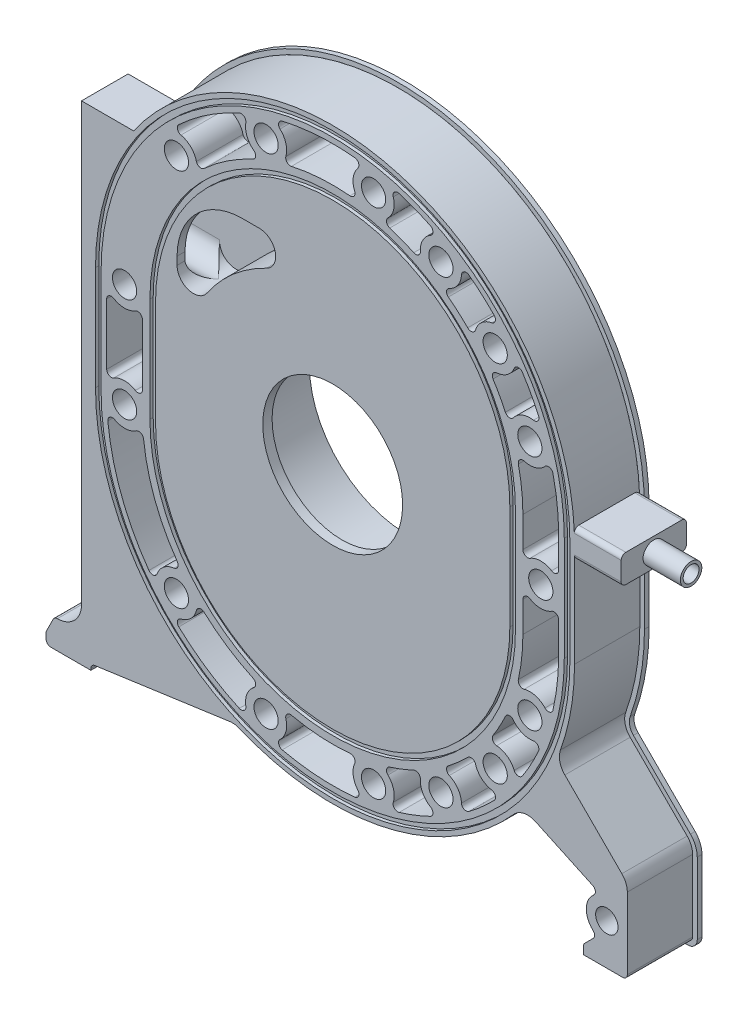
from build123d import *
from build123d.topology import SkipClean

# Parameters (mm, degrees)
BOSS_EXTRUDE1_START             = -25
BOSS_EXTRUDE1_OUTLINE_R         = 6.5
BOSS_EXTRUDE1_OUTLINE_R_2       = 6
BOSS_EXTRUDE1_DEPTH             = 50
SKETCH3_R                       = 37.5
CUT_EXTRUDE1_DEPTH              = 231.616869775
CUT_EXTRUDE2_DEPTH              = 60
CUT_EXTRUDE3_REACH              = 232.617
CUT_EXTRUDE4_REACH              = 285.707
CUT_EXTRUDE5_DEPTH              = 1.75
BOSS_EXTRUDE2_START             = -10
SKETCH1_5_R                     = 6.5
SKETCH1_5_R_2                   = 6
BOSS_EXTRUDE2_DEPTH             = 10
SKETCH9_R                       = 52.5
CUT_EXTRUDE6_DEPTH              = 30
EXTRUDE_THIN1_START             = 2.5
SKETCH11_R                      = 9
SKETCH11_R_2                    = 6.5
EXTRUDE_THIN1_DEPTH             = 2.5
SKETCH12_R                      = 67.5
SKETCH12_R_2                    = 3.125
SKETCH12_R_3                    = 52.5
BOSS_EXTRUDE4_DEPTH             = 5
BOSS_EXTRUDE8_DEPTH             = 25
BOSS_EXTRUDE8_DIRECTION_2_REACH = 331.971
CUT_EXTRUDE7_DEPTH              = 352.851730179
CUT_EXTRUDE7_DEPTH_BACK         = 45
SKETCH14_R                      = 4.25
EXTRUDE_THIN3_OUTLINE_R         = 5.75
EXTRUDE_THIN3_OUTLINE_R_2       = 4.25
EXTRUDE_THIN3_DEPTH             = 20


# Read off the part's stored shape, not the designer's step: Boss-Extrude1, Extrude-Thin3
with BuildPart() as part:
    # Boss-Extrude1 outline → Boss-Extrude1 (new body)
    with BuildSketch(Plane.XY.offset(BOSS_EXTRUDE1_START)):
        with BuildLine():
            Line((129.69, -27.875), (129.69, 27.875))
            ThreePointArc((129.69, 27.875), (38.606968436, 151.685331105), (-106.70444966, 101.588340195))
            Line((-106.70444966, 101.588340195), (-134.69, 101.588340195))
            Line((-134.69, 101.588340195), (-134.69, -132.375))
            ThreePointArc((-134.69, -132.375), (-138.484242845, -141.553999684), (-147.652159261, -145.374944926))
            ThreePointArc((-147.652159261, -145.374944926), (-148.962303708, -145.750222458), (-149.880950173, -146.756900346))
            Line((-149.880950173, -146.756900346), (-153.426067978, -153.847135955))
            ThreePointArc((-153.426067978, -153.847135955), (-153.623122474, -154.390787642), (-153.69, -154.965169944))
            Line((-153.69, -154.965169944), (-153.69, -157.875))
            ThreePointArc((-153.69, -157.875), (-152.957766953, -159.642766953), (-151.19, -160.375))
            Line((-151.19, -160.375), (-129.69, -160.375))
            Line((-129.69, -160.375), (-129.69, -159.548216845))
            ThreePointArc((-129.69, -159.548216845), (-129.076773951, -157.908069272), (-127.537932752, -157.072546673))
            Line((-127.537932752, -157.072546673), (-55.158579324, -146.900291927))
            ThreePointArc((-55.158579324, -146.900291927), (-52.4929471, -146.884445723), (-49.917836337, -147.573394791))
            ThreePointArc((-49.917836337, -147.573394791), (28.987217754, -154.284008013), (97.084575956, -113.863843529))
            ThreePointArc((97.084575956, -113.863843529), (102.536758276, -110.703163877), (108.796653859, -111.431102888))
            Line((108.796653859, -111.431102888), (139.437181695, -125.719015668))
            ThreePointArc((139.437181695, -125.719015668), (140.860155542, -127.665437295), (139.976814552, -129.908898999))
            ThreePointArc((139.976814552, -129.908898999), (136.002465891, -138.142097602), (139.624687231, -146.536174031))
            ThreePointArc((139.624687231, -146.536174031), (140.447681655, -148.3278198), (139.716246737, -150.158753263))
            Line((139.716246737, -150.158753263), (135.232233047, -154.642766953))
            ThreePointArc((135.232233047, -154.642766953), (134.690301169, -155.453825325), (134.5, -156.410533906))
            Line((134.5, -156.410533906), (134.5, -160.375))
            Line((134.5, -160.375), (155.5, -160.375))
            ThreePointArc((155.5, -160.375), (157.267766953, -159.642766953), (158, -157.875))
            Line((158, -157.875), (158, -119.517135624))
            ThreePointArc((158, -119.517135624), (157.238795325, -115.6903013), (155.071067812, -112.446067812))
            Line((155.071067812, -112.446067812), (124.500071536, -81.875071536))
            ThreePointArc((124.500071536, -81.875071536), (121.81521137, -76.99987924), (122.152344922, -71.444493114))
            ThreePointArc((122.152344922, -71.444493114), (127.791693222, -49.983352349), (129.69, -27.875))
        make_face()
        with Locations((-83.790831702, -101.588340195)):
            Circle(BOSS_EXTRUDE1_OUTLINE_R, mode=Mode.SUBTRACT)
        with Locations((-35.708318761, -133.608041058)):
            Circle(BOSS_EXTRUDE1_OUTLINE_R, mode=Mode.SUBTRACT)
        with BuildLine():
            ThreePointArc((11.802296503, -132.930451523), (11.019268702, -138.900082628), (13.484906294, -144.392828692))
            ThreePointArc((13.484906294, -144.392828692), (13.884371714, -146.944502352), (11.813453088, -148.487845195))
            ThreePointArc((11.813453088, -148.487845195), (-7.738201491, -148.817698571), (-27.088392238, -145.998812612))
            ThreePointArc((-27.088392238, -145.998812612), (-28.945736068, -144.204130193), (-28.224334891, -141.724172244))
            ThreePointArc((-28.224334891, -141.724172244), (-25.078790134, -136.590442972), (-25.094645122, -130.569697447))
            ThreePointArc((-25.094645122, -130.569697447), (-24.511119871, -128.167653252), (-22.148335068, -127.441315859))
            ThreePointArc((-22.148335068, -127.441315859), (-6.512885156, -129.666857862), (9.278701432, -129.452092397))
            ThreePointArc((9.278701432, -129.452092397), (11.529653187, -130.473627628), (11.802296503, -132.930451523))
        make_face(mode=Mode.SUBTRACT)
        with BuildLine():
            ThreePointArc((-42.306637167, -124.756838077), (-45.969574687, -129.535176364), (-46.580642928, -135.524852788))
            ThreePointArc((-46.580642928, -135.524852788), (-47.510532556, -137.934399709), (-50.075672117, -138.235514506))
            ThreePointArc((-50.075672117, -138.235514506), (-67.172828356, -128.74534862), (-82.521142132, -116.629026395))
            ThreePointArc((-82.521142132, -116.629026395), (-83.232307863, -114.146113914), (-81.367577143, -112.359107918))
            ThreePointArc((-81.367577143, -112.359107918), (-76.076590838, -109.48594033), (-73.079948898, -104.263894262))
            ThreePointArc((-73.079948898, -104.263894262), (-71.373579109, -102.475425594), (-68.96417875, -103.027791361))
            ThreePointArc((-68.96417875, -103.027791361), (-56.536252928, -112.772892229), (-42.752955044, -120.482693174))
            ThreePointArc((-42.752955044, -120.482693174), (-41.314341257, -122.492844513), (-42.306637167, -124.756838077))
        make_face(mode=Mode.SUBTRACT)
        with BuildLine():
            ThreePointArc((-85.079541574, -90.623814356), (-90.640907662, -92.93050794), (-94.164946494, -97.812185764))
            ThreePointArc((-94.164946494, -97.812185764), (-96.175027996, -99.433969795), (-98.547061418, -98.412173079))
            ThreePointArc((-98.547061418, -98.412173079), (-113.38922347, -70.652331624), (-120.581280229, -40.006403811))
            ThreePointArc((-120.581280229, -40.006403811), (-119.475235387, -37.672463817), (-116.894827512, -37.562435244))
            ThreePointArc((-116.894827512, -37.562435244), (-111.024514584, -38.899990546), (-105.325360652, -36.958529108))
            ThreePointArc((-105.325360652, -36.958529108), (-102.862886251, -36.74280276), (-101.418720173, -38.748968848))
            ThreePointArc((-101.418720173, -38.748968848), (-95.434448337, -63.878695236), (-83.328991742, -86.699137353))
            ThreePointArc((-83.328991742, -86.699137353), (-83.088191325, -89.159286371), (-85.079541574, -90.623814356))
        make_face(mode=Mode.SUBTRACT)
        with Locations((-111.6, -27.875)):
            Circle(BOSS_EXTRUDE1_OUTLINE_R, mode=Mode.SUBTRACT)
        with Locations((21.942209355, -137.296658956)):
            Circle(BOSS_EXTRUDE1_OUTLINE_R, mode=Mode.SUBTRACT)
        with BuildLine():
            ThreePointArc((47.021611519, -122.558209428), (48.327540158, -128.435639007), (52.523111405, -132.753834228))
            ThreePointArc((52.523111405, -132.753834228), (53.771209903, -135.014997917), (52.353037294, -137.173561684))
            ThreePointArc((52.353037294, -137.173561684), (44.099400772, -140.756614763), (35.60267048, -143.717418633))
            ThreePointArc((35.60267048, -143.717418633), (33.09682233, -143.091849982), (32.481595101, -140.583442809))
            ThreePointArc((32.481595101, -140.583442809), (32.638852133, -134.564730464), (29.614748548, -129.358539384))
            ThreePointArc((29.614748548, -129.358539384), (28.919074143, -126.986545465), (30.602137109, -125.176126429))
            ThreePointArc((30.602137109, -125.176126429), (37.116419496, -122.88221764), (43.460538967, -120.152741372))
            ThreePointArc((43.460538967, -120.152741372), (45.925127347, -120.342799649), (47.021611519, -122.558209428))
        make_face(mode=Mode.SUBTRACT)
        with Locations((58.043343694, -123.193047886)):
            Circle(BOSS_EXTRUDE1_OUTLINE_R, mode=Mode.SUBTRACT)
        with BuildLine():
            ThreePointArc((76.569426221, -100.765774901), (79.806797034, -105.842098205), (85.226254123, -108.46490451))
            ThreePointArc((85.226254123, -108.46490451), (87.1724466, -110.162828515), (86.578072553, -112.676258558))
            ThreePointArc((86.578072553, -112.676258558), (80.047667547, -118.866137043), (73.076007354, -124.554435503))
            ThreePointArc((73.076007354, -124.554435503), (70.50732326, -124.823643801), (69.071272992, -122.676932196))
            ThreePointArc((69.071272992, -122.676932196), (67.160525406, -116.967407546), (62.538175363, -113.109492547))
            ThreePointArc((62.538175363, -113.109492547), (61.073185557, -111.118482025), (62.035547628, -108.84160318))
            ThreePointArc((62.035547628, -108.84160318), (67.372407705, -104.458018222), (72.400394092, -99.723332864))
            ThreePointArc((72.400394092, -99.723332864), (74.781353365, -99.058990353), (76.569426221, -100.765774901))
        make_face(mode=Mode.SUBTRACT)
        with Locations((147, -138.375)):
            Circle(BOSS_EXTRUDE1_OUTLINE_R_2, mode=Mode.SUBTRACT)
        with Locations((87.143594155, -97.592673497)):
            Circle(BOSS_EXTRUDE1_OUTLINE_R, mode=Mode.SUBTRACT)
        with BuildLine():
            ThreePointArc((96.881838077, -70.181637167), (101.660176364, -73.844574687), (107.649852788, -74.455642928))
            ThreePointArc((107.649852788, -74.455642928), (110.059399709, -75.385532556), (110.360514506, -77.950672117))
            ThreePointArc((110.360514506, -77.950672117), (106.341004237, -86.000785309), (101.735299255, -93.730485615))
            ThreePointArc((101.735299255, -93.730485615), (99.413600426, -94.862000368), (97.329935976, -93.335909432))
            ThreePointArc((97.329935976, -93.335909432), (93.58164813, -88.624225414), (87.918575263, -86.579907982))
            ThreePointArc((87.918575263, -86.579907982), (85.860969449, -85.21002611), (85.986555557, -82.741312647))
            ThreePointArc((85.986555557, -82.741312647), (89.502289234, -76.796776562), (92.607693174, -70.627955044))
            ThreePointArc((92.607693174, -70.627955044), (94.617844513, -69.189341257), (96.881838077, -70.181637167))
        make_face(mode=Mode.SUBTRACT)
        with Locations((105.733041058, -63.583318761)):
            Circle(BOSS_EXTRUDE1_OUTLINE_R, mode=Mode.SUBTRACT)
        with BuildLine():
            ThreePointArc((105.810930576, -9.40044016), (111.595213419, -11.039998962), (117.380915805, -9.405456526))
            ThreePointArc((117.380915805, -9.405456526), (119.910100306, -9.353262352), (121.19, -11.53531534))
            Line((121.19, -11.53531534), (121.19, -27.875))
            ThreePointArc((121.19, -27.875), (120.421013429, -41.505686879), (118.123812612, -54.963392238))
            ThreePointArc((118.123812612, -54.963392238), (116.329130193, -56.820736068), (113.849172244, -56.099334891))
            ThreePointArc((113.849172244, -56.099334891), (108.715442972, -52.953790134), (102.694697447, -52.969645122))
            ThreePointArc((102.694697447, -52.969645122), (100.292653252, -52.386119871), (99.566315859, -50.023335068))
            ThreePointArc((99.566315859, -50.023335068), (101.38975347, -39.015820939), (102, -27.875))
            Line((102, -27.875), (102, -11.529163023))
            ThreePointArc((102, -11.529163023), (103.280845875, -9.346581244), (105.810930576, -9.40044016))
        make_face(mode=Mode.SUBTRACT)
        with BuildLine():
            ThreePointArc((-117.380915805, 18.469543474), (-111.595213419, 16.835001038), (-105.810930576, 18.47455984))
            ThreePointArc((-105.810930576, 18.47455984), (-103.280845875, 18.528418756), (-102, 16.345836977))
            Line((-102, 16.345836977), (-102, -16.345836977))
            ThreePointArc((-102, -16.345836977), (-103.280845875, -18.528418756), (-105.810930576, -18.47455984))
            ThreePointArc((-105.810930576, -18.47455984), (-111.595213419, -16.835001038), (-117.380915805, -18.469543474))
            ThreePointArc((-117.380915805, -18.469543474), (-119.910100306, -18.521737648), (-121.19, -16.33968466))
            Line((-121.19, -16.33968466), (-121.19, 16.33968466))
            ThreePointArc((-121.19, 16.33968466), (-119.910100306, 18.521737648), (-117.380915805, 18.469543474))
        make_face(mode=Mode.SUBTRACT)
        with Locations((-111.6, 27.875)):
            Circle(BOSS_EXTRUDE1_OUTLINE_R, mode=Mode.SUBTRACT)
        with Locations((-83.790831702, 101.588340195)):
            Circle(BOSS_EXTRUDE1_OUTLINE_R, mode=Mode.SUBTRACT)
        with BuildLine():
            ThreePointArc((-46.580642928, 135.524852788), (-45.969574687, 129.535176364), (-42.306637167, 124.756838077))
            ThreePointArc((-42.306637167, 124.756838077), (-41.314341257, 122.492844513), (-42.752955044, 120.482693174))
            ThreePointArc((-42.752955044, 120.482693174), (-56.536252928, 112.772892229), (-68.96417875, 103.027791361))
            ThreePointArc((-68.96417875, 103.027791361), (-71.373579109, 102.475425594), (-73.079948898, 104.263894262))
            ThreePointArc((-73.079948898, 104.263894262), (-76.076590838, 109.48594033), (-81.367577143, 112.359107918))
            ThreePointArc((-81.367577143, 112.359107918), (-83.232307863, 114.146113914), (-82.521142132, 116.629026395))
            ThreePointArc((-82.521142132, 116.629026395), (-67.172828356, 128.74534862), (-50.075672117, 138.235514506))
            ThreePointArc((-50.075672117, 138.235514506), (-47.510532556, 137.934399709), (-46.580642928, 135.524852788))
        make_face(mode=Mode.SUBTRACT)
        with Locations((-35.708318761, 133.608041058)):
            Circle(BOSS_EXTRUDE1_OUTLINE_R, mode=Mode.SUBTRACT)
        with BuildLine():
            ThreePointArc((13.484906294, 144.392828692), (11.019268702, 138.900082628), (11.802296503, 132.930451523))
            ThreePointArc((11.802296503, 132.930451523), (11.529653187, 130.473627628), (9.278701432, 129.452092397))
            ThreePointArc((9.278701432, 129.452092397), (-6.512885156, 129.666857862), (-22.148335068, 127.441315859))
            ThreePointArc((-22.148335068, 127.441315859), (-24.511119871, 128.167653252), (-25.094645122, 130.569697447))
            ThreePointArc((-25.094645122, 130.569697447), (-25.078790134, 136.590442972), (-28.224334891, 141.724172244))
            ThreePointArc((-28.224334891, 141.724172244), (-28.945736068, 144.204130193), (-27.088392238, 145.998812612))
            ThreePointArc((-27.088392238, 145.998812612), (-7.738201491, 148.817698571), (11.813453088, 148.487845195))
            ThreePointArc((11.813453088, 148.487845195), (13.884371714, 146.944502352), (13.484906294, 144.392828692))
        make_face(mode=Mode.SUBTRACT)
        with Locations((111.6, 0)):
            Circle(BOSS_EXTRUDE1_OUTLINE_R, mode=Mode.SUBTRACT)
        with BuildLine():
            ThreePointArc((117.380915805, 9.405456526), (111.595213419, 11.039998962), (105.810930576, 9.40044016))
            ThreePointArc((105.810930576, 9.40044016), (103.280845875, 9.346581244), (102, 11.529163023))
            Line((102, 11.529163023), (102, 27.875))
            ThreePointArc((102, 27.875), (101.38975347, 39.015820939), (99.566315859, 50.023335068))
            ThreePointArc((99.566315859, 50.023335068), (100.292653252, 52.386119871), (102.694697447, 52.969645122))
            ThreePointArc((102.694697447, 52.969645122), (108.715442972, 52.953790134), (113.849172244, 56.099334891))
            ThreePointArc((113.849172244, 56.099334891), (116.329130193, 56.820736068), (118.123812612, 54.963392238))
            ThreePointArc((118.123812612, 54.963392238), (120.421013429, 41.505686879), (121.19, 27.875))
            Line((121.19, 27.875), (121.19, 11.53531534))
            ThreePointArc((121.19, 11.53531534), (119.910100306, 9.353262352), (117.380915805, 9.405456526))
        make_face(mode=Mode.SUBTRACT)
        with Locations((105.733041058, 63.583318761)):
            Circle(BOSS_EXTRUDE1_OUTLINE_R, mode=Mode.SUBTRACT)
        with BuildLine():
            ThreePointArc((62.538175363, 113.109492547), (67.160525406, 116.967407546), (69.071272992, 122.676932196))
            ThreePointArc((69.071272992, 122.676932196), (70.50732326, 124.823643801), (73.076007354, 124.554435503))
            ThreePointArc((73.076007354, 124.554435503), (80.047667547, 118.866137043), (86.578072553, 112.676258558))
            ThreePointArc((86.578072553, 112.676258558), (87.1724466, 110.162828515), (85.226254123, 108.46490451))
            ThreePointArc((85.226254123, 108.46490451), (79.806797034, 105.842098205), (76.569426221, 100.765774901))
            ThreePointArc((76.569426221, 100.765774901), (74.781353365, 99.058990353), (72.400394092, 99.723332864))
            ThreePointArc((72.400394092, 99.723332864), (67.372407705, 104.458018222), (62.035547628, 108.84160318))
            ThreePointArc((62.035547628, 108.84160318), (61.073185557, 111.118482025), (62.538175363, 113.109492547))
        make_face(mode=Mode.SUBTRACT)
        with Locations((21.942209355, 137.296658956)):
            Circle(BOSS_EXTRUDE1_OUTLINE_R, mode=Mode.SUBTRACT)
        with Locations((58.043343694, 123.193047886)):
            Circle(BOSS_EXTRUDE1_OUTLINE_R, mode=Mode.SUBTRACT)
        with BuildLine():
            ThreePointArc((29.614748548, 129.358539384), (32.638852133, 134.564730464), (32.481595101, 140.583442809))
            ThreePointArc((32.481595101, 140.583442809), (33.09682233, 143.091849982), (35.60267048, 143.717418633))
            ThreePointArc((35.60267048, 143.717418633), (44.099400772, 140.756614763), (52.353037294, 137.173561684))
            ThreePointArc((52.353037294, 137.173561684), (53.771209903, 135.014997917), (52.523111405, 132.753834228))
            ThreePointArc((52.523111405, 132.753834228), (48.327540158, 128.435639007), (47.021611519, 122.558209428))
            ThreePointArc((47.021611519, 122.558209428), (45.925127347, 120.342799649), (43.460538967, 120.152741372))
            ThreePointArc((43.460538967, 120.152741372), (37.116419496, 122.88221764), (30.602137109, 125.176126429))
            ThreePointArc((30.602137109, 125.176126429), (28.919074143, 126.986545465), (29.614748548, 129.358539384))
        make_face(mode=Mode.SUBTRACT)
        with BuildLine():
            ThreePointArc((87.918575263, 86.579907982), (93.58164813, 88.624225414), (97.329935976, 93.335909432))
            ThreePointArc((97.329935976, 93.335909432), (99.413600426, 94.862000368), (101.735299255, 93.730485615))
            ThreePointArc((101.735299255, 93.730485615), (106.341004237, 86.000785309), (110.360514506, 77.950672117))
            ThreePointArc((110.360514506, 77.950672117), (110.059399709, 75.385532556), (107.649852788, 74.455642928))
            ThreePointArc((107.649852788, 74.455642928), (101.660176364, 73.844574687), (96.881838077, 70.181637167))
            ThreePointArc((96.881838077, 70.181637167), (94.617844513, 69.189341257), (92.607693174, 70.627955044))
            ThreePointArc((92.607693174, 70.627955044), (89.502289234, 76.796776562), (85.986555557, 82.741312647))
            ThreePointArc((85.986555557, 82.741312647), (85.860969449, 85.21002611), (87.918575263, 86.579907982))
        make_face(mode=Mode.SUBTRACT)
        with Locations((87.143594155, 97.592673497)):
            Circle(BOSS_EXTRUDE1_OUTLINE_R, mode=Mode.SUBTRACT)
    extrude(amount=BOSS_EXTRUDE1_DEPTH)

    # Sketch3 → Cut-Extrude1 (cut, through all)
    with BuildSketch(Plane.XY.offset(25)):
        Circle(SKETCH3_R)
    extrude(amount=-CUT_EXTRUDE1_DEPTH, mode=Mode.SUBTRACT)

    # Sketch4 → Cut-Extrude2 (cut)
    with BuildSketch(Plane.ZY.offset(134.69)):
        with BuildLine():
            Line((-2.25, 80.838340195), (-2.25, 51.338340195))
            ThreePointArc((-2.25, 51.338340195), (-11.5, 42.088340195), (-20.75, 51.338340195))
            Line((-20.75, 51.338340195), (-20.75, 80.838340195))
            ThreePointArc((-20.75, 80.838340195), (-11.5, 90.088340195), (-2.25, 80.838340195))
        make_face()
    cut_extrude2 = extrude(amount=-CUT_EXTRUDE2_DEPTH, mode=Mode.SUBTRACT)

    # Cut-Extrude3: up to this face of the body (flat: up to its plane)
    cut_extrude3_end = Plane(part.part.faces().sort_by_distance((-104.69, 66.088340195, -2.25))[0])
    # Sketch6 → Cut-Extrude3 (cut, up to the picked face)
    with BuildSketch(Plane(origin=(0, 0, -25), x_dir=(-1, 0, 0), z_dir=(0, 0, -1)), mode=Mode.PRIVATE) as cut_extrude3_sk1:
        with BuildLine():
            ThreePointArc((81.923393274, 55.76180663), (64.732125124, 75.037146941), (43.14393299, 89.215595556))
            ThreePointArc((43.14393299, 89.215595556), (31.457301305, 85.147716519), (35.525180342, 73.461084834))
            ThreePointArc((35.525180342, 73.461084834), (53.30113088, 61.78639713), (67.456606726, 45.91487376))
            ThreePointArc((67.456606726, 45.91487376), (79.613466435, 43.60494692), (81.923393274, 55.76180663))
        make_face()
    cut_extrude3_tool1 = split(extrude(cut_extrude3_sk1.sketch, amount=-CUT_EXTRUDE3_REACH, mode=Mode.PRIVATE), bisect_by=cut_extrude3_end, keep=Keep.BOTH, mode=Mode.PRIVATE)
    # Sketch6 → Cut-Extrude3 (cut, up to the picked face)
    with BuildSketch(Plane(origin=(0, 0, -25), x_dir=(-1, 0, 0), z_dir=(0, 0, -1)), mode=Mode.PRIVATE) as cut_extrude3_sk2:
        with BuildLine():
            Line((48.44, 90.088340195), (39.334556666, 90.088340195))
            ThreePointArc((39.334556666, 90.088340195), (41.288592949, 89.867363715), (43.14393299, 89.215595556))
            ThreePointArc((43.14393299, 89.215595556), (64.732125124, 75.037146941), (81.923393274, 55.76180663))
            ThreePointArc((81.923393274, 55.76180663), (83.052257206, 53.414219545), (83.44, 50.838340195))
            Line((83.44, 50.838340195), (83.44, 55.088340195))
            ThreePointArc((83.44, 55.088340195), (73.188737342, 79.837077536), (48.44, 90.088340195))
        make_face()
    cut_extrude3_tool2 = split(extrude(cut_extrude3_sk2.sketch, amount=-CUT_EXTRUDE3_REACH, mode=Mode.PRIVATE), bisect_by=cut_extrude3_end, keep=Keep.BOTH, mode=Mode.PRIVATE)
    cut_extrude3_1 = cut_extrude3_tool1.solids().sort_by(Axis((-58.046121, 67.286765, -25), (0, 0, 1)))[0]
    add(cut_extrude3_1, mode=Mode.SUBTRACT)
    cut_extrude3_2 = cut_extrude3_tool2.solids().sort_by(Axis((-67.330054, 76.676375, -25), (0, 0, 1)))[0]
    add(cut_extrude3_2, mode=Mode.SUBTRACT)
    cut_extrude3 = cut_extrude3_1 + cut_extrude3_2  # Cut-Extrude3 as one shape, for the pattern or mirror that repeats it

    # Sketch7 → Cut-Extrude4 (cut, up to next)
    with BuildSketch(Plane.ZY.offset(74.69), mode=Mode.PRIVATE) as cut_extrude4_sk1:
        with BuildLine():
            Line((-20.75, 80.838340195), (-20.75, 78.238664167))
            Line((-20.75, 78.238664167), (-2.25, 78.238664167))
            Line((-2.25, 78.238664167), (-2.25, 80.838340195))
            ThreePointArc((-2.25, 80.838340195), (-11.5, 90.088340195), (-20.75, 80.838340195))
        make_face()
    cut_extrude4_tool1 = extrude(cut_extrude4_sk1.sketch, amount=-CUT_EXTRUDE4_REACH, mode=Mode.PRIVATE) & part.part
    cut_extrude4 = cut_extrude4_tool1.solids().sort_by_distance((-74.69, 83.387015, -11.5))[0]
    add(cut_extrude4, mode=Mode.SUBTRACT)

    # Sketch8 → Cut-Extrude5 (cut)
    # profile 1 of 2: a face of its own
    with BuildSketch(Plane(origin=(0, 0, -25), x_dir=(-1, 0, 0), z_dir=(0, 0, -1))):
        with BuildLine():
            Line((-127.19, 27.875), (-127.19, -27.875))
            ThreePointArc((-127.19, -27.875), (0, -155.065), (127.19, -27.875))
            Line((127.19, -27.875), (127.19, 27.875))
            ThreePointArc((127.19, 27.875), (0, 155.065), (-127.19, 27.875))
        make_face()
        with BuildLine():
            ThreePointArc((-124.19, -27.875), (0, -152.065), (124.19, -27.875))
            Line((124.19, -27.875), (124.19, 27.875))
            ThreePointArc((124.19, 27.875), (0, 152.065), (-124.19, 27.875))
            Line((-124.19, 27.875), (-124.19, -27.875))
        make_face(mode=Mode.SUBTRACT)
    # profile 2 of 2: a face of its own
    with BuildSketch(Plane(origin=(0, 0, -25), x_dir=(-1, 0, 0), z_dir=(0, 0, -1))):
        with BuildLine():
            Line((98, -27.875), (98, 27.875))
            ThreePointArc((98, 27.875), (0, 125.875), (-98, 27.875))
            Line((-98, 27.875), (-98, -27.875))
            ThreePointArc((-98, -27.875), (0, -125.875), (98, -27.875))
        make_face()
        with BuildLine():
            ThreePointArc((-95, -27.875), (0, -122.875), (95, -27.875))
            Line((95, -27.875), (95, 27.875))
            ThreePointArc((95, 27.875), (0, 122.875), (-95, 27.875))
            Line((-95, 27.875), (-95, -27.875))
        make_face(mode=Mode.SUBTRACT)
    cut_extrude5 = extrude(amount=-CUT_EXTRUDE5_DEPTH, mode=Mode.SUBTRACT)

    # Mirror1: Cut-Extrude2, Cut-Extrude3, Cut-Extrude4, Cut-Extrude5 across plane
    add(cut_extrude2.mirror(Plane.XY), mode=Mode.SUBTRACT)
    add(cut_extrude3.mirror(Plane.XY), mode=Mode.SUBTRACT)
    add(cut_extrude4.mirror(Plane.XY), mode=Mode.SUBTRACT)
    add(cut_extrude5.mirror(Plane.XY), mode=Mode.SUBTRACT)

    # SurfaceCut1
    split(bisect_by=Plane.XY, keep=Keep.TOP)

    # Sketch1<5> → Boss-Extrude2 (add)
    with BuildSketch(Plane.XY.offset(BOSS_EXTRUDE2_START)):
        with BuildLine():
            ThreePointArc((124.500071536, -81.875071536), (121.81521137, -76.99987924), (122.152344922, -71.444493114))
            ThreePointArc((122.152344922, -71.444493114), (127.791693222, -49.983352348), (129.69, -27.875))
            Line((129.69, -27.875), (129.69, 27.875))
            ThreePointArc((129.69, 27.875), (38.606968435, 151.685331105), (-106.70444966, 101.588340195))
            ThreePointArc((-106.70444966, 101.588340195), (-117.45304508, 82.868438712), (-124.947723469, 62.625))
            Line((-124.947723469, 62.625), (-134.69, 62.625))
            Line((-134.69, 62.625), (-134.69, 57.625))
            Line((-134.69, 57.625), (-126.231666392, 57.625))
            ThreePointArc((-126.231666392, 57.625), (-128.822515335, 42.85016754), (-129.69, 27.875))
            Line((-129.69, 27.875), (-129.69, -31.763787319))
            Line((-129.69, -31.763787319), (-134.69, -31.763787319))
            Line((-134.69, -31.763787319), (-134.69, -132.375))
            ThreePointArc((-134.69, -132.375), (-138.484242845, -141.553999684), (-147.652159261, -145.374944926))
            ThreePointArc((-147.652159261, -145.374944926), (-148.962303708, -145.750222458), (-149.880950173, -146.756900346))
            Line((-149.880950173, -146.756900346), (-153.426067977, -153.847135955))
            ThreePointArc((-153.426067977, -153.847135955), (-153.623122474, -154.390787642), (-153.69, -154.965169944))
            Line((-153.69, -154.965169944), (-153.69, -157.875))
            ThreePointArc((-153.69, -157.875), (-152.957766953, -159.642766953), (-151.19, -160.375))
            Line((-151.19, -160.375), (-129.69, -160.375))
            Line((-129.69, -160.375), (-129.69, -159.548216845))
            ThreePointArc((-129.69, -159.548216845), (-129.076773951, -157.908069272), (-127.537932752, -157.072546673))
            Line((-127.537932752, -157.072546673), (-55.158579324, -146.900291927))
            ThreePointArc((-55.158579324, -146.900291927), (-52.492947099, -146.884445723), (-49.917836337, -147.573394791))
            ThreePointArc((-49.917836337, -147.573394791), (28.987217755, -154.284008013), (97.084575956, -113.863843529))
            ThreePointArc((97.084575956, -113.863843529), (102.536758276, -110.703163877), (108.796653859, -111.431102888))
            Line((108.796653859, -111.431102888), (139.437181695, -125.719015668))
            ThreePointArc((139.437181695, -125.719015668), (140.860155542, -127.665437295), (139.976814552, -129.908898999))
            ThreePointArc((139.976814552, -129.908898999), (136.002465891, -138.142097602), (139.624687231, -146.536174031))
            ThreePointArc((139.624687231, -146.536174031), (140.447681655, -148.3278198), (139.716246737, -150.158753263))
            Line((139.716246737, -150.158753263), (135.232233047, -154.642766953))
            ThreePointArc((135.232233047, -154.642766953), (134.690301169, -155.453825325), (134.5, -156.410533906))
            Line((134.5, -156.410533906), (134.5, -160.375))
            Line((134.5, -160.375), (155.5, -160.375))
            ThreePointArc((155.5, -160.375), (157.267766953, -159.642766953), (158, -157.875))
            Line((158, -157.875), (158, -119.517135624))
            ThreePointArc((158, -119.517135624), (157.238795325, -115.6903013), (155.071067812, -112.446067812))
            Line((155.071067812, -112.446067812), (124.500071536, -81.875071536))
        make_face()
        with Locations((-83.790831702, -101.588340195)):
            Circle(SKETCH1_5_R, mode=Mode.SUBTRACT)
        with Locations((-35.708318761, -133.608041058)):
            Circle(SKETCH1_5_R, mode=Mode.SUBTRACT)
        with Locations((-111.6, -27.875)):
            Circle(SKETCH1_5_R, mode=Mode.SUBTRACT)
        with Locations((21.942209355, -137.296658956)):
            Circle(SKETCH1_5_R, mode=Mode.SUBTRACT)
        with Locations((58.043343694, -123.193047886)):
            Circle(SKETCH1_5_R, mode=Mode.SUBTRACT)
        with Locations((147, -138.375)):
            Circle(SKETCH1_5_R_2, mode=Mode.SUBTRACT)
        with Locations((87.143594155, -97.592673497)):
            Circle(SKETCH1_5_R, mode=Mode.SUBTRACT)
        with Locations((105.733041058, -63.583318761)):
            Circle(SKETCH1_5_R, mode=Mode.SUBTRACT)
        with Locations((-111.6, 27.875)):
            Circle(SKETCH1_5_R, mode=Mode.SUBTRACT)
        with Locations((-83.790831702, 101.588340195)):
            Circle(SKETCH1_5_R, mode=Mode.SUBTRACT)
        with Locations((-35.708318761, 133.608041058)):
            Circle(SKETCH1_5_R, mode=Mode.SUBTRACT)
        with Locations((111.6, 0)):
            Circle(SKETCH1_5_R, mode=Mode.SUBTRACT)
        with Locations((105.733041058, 63.583318761)):
            Circle(SKETCH1_5_R, mode=Mode.SUBTRACT)
        with Locations((21.942209355, 137.296658956)):
            Circle(SKETCH1_5_R, mode=Mode.SUBTRACT)
        with Locations((58.043343694, 123.193047886)):
            Circle(SKETCH1_5_R, mode=Mode.SUBTRACT)
        with Locations((87.143594155, 97.592673497)):
            Circle(SKETCH1_5_R, mode=Mode.SUBTRACT)
    extrude(amount=BOSS_EXTRUDE2_DEPTH)

    # Sketch9 → Cut-Extrude6 (cut)
    with BuildSketch(Plane(origin=(0, 0, -10), x_dir=(-1, 0, 0), z_dir=(0, 0, -1))):
        Circle(SKETCH9_R)
    extrude(amount=-CUT_EXTRUDE6_DEPTH, mode=Mode.SUBTRACT)

    # Sketch11 → Extrude-Thin1 (add)
    # profile 1 of 16: a face of its own
    with BuildSketch(Plane(origin=(0, 0, -10), x_dir=(-1, 0, 0), z_dir=(0, 0, -1)).offset(EXTRUDE_THIN1_START)):
        with BuildLine():
            Line((-132.19, 27.875), (-132.19, -27.875))
            ThreePointArc((-132.19, -27.875), (-130.255100061, -50.409529239), (-124.507043528, -72.284370766))
            ThreePointArc((-124.507043528, -72.284370766), (-124.254193364, -76.450910361), (-126.267838489, -80.107304583))
            Line((-126.267838489, -80.107304583), (-156.838834765, -110.678300859))
            ThreePointArc((-156.838834765, -110.678300859), (-159.548494156, -114.733592719), (-160.5, -119.517135624))
            Line((-160.5, -119.517135624), (-160.5, -157.875))
            ThreePointArc((-160.5, -157.875), (-159.035533906, -161.410533906), (-155.5, -162.875))
            Line((-155.5, -162.875), (-132, -162.875))
            Line((-132, -162.875), (-132, -156.410533906))
            ThreePointArc((-132, -156.410533906), (-132.380602337, -154.497116744), (-133.464466094, -152.875))
            Line((-133.464466094, -152.875), (-137.948479784, -148.39098631))
            ThreePointArc((-137.948479784, -148.39098631), (-133.503026321, -138.089165239), (-138.380636041, -127.984785135))
            Line((-138.380636041, -127.984785135), (-107.740108205, -113.696872355))
            ThreePointArc((-107.740108205, -113.696872355), (-103.045186518, -113.150918097), (-98.956049778, -115.521427836))
            ThreePointArc((-98.956049778, -115.521427836), (-29.545996723, -156.720761194), (50.880089331, -149.880789247))
            ThreePointArc((50.880089331, -149.880789247), (52.811422403, -149.364077445), (54.810646571, -149.375962098))
            Line((54.810646571, -149.375962098), (127.19, -159.548216845))
            Line((127.19, -159.548216845), (127.19, -162.875))
            Line((127.19, -162.875), (151.19, -162.875))
            ThreePointArc((151.19, -162.875), (154.725533906, -161.410533906), (156.19, -157.875))
            Line((156.19, -157.875), (156.19, -154.965169944))
            ThreePointArc((156.19, -154.965169944), (156.056244947, -153.816405341), (155.662135955, -152.729101966))
            Line((155.662135955, -152.729101966), (152.117018151, -145.638866357))
            ThreePointArc((152.117018151, -145.638866357), (150.27972522, -143.625510581), (147.659436326, -142.874955517))
            ThreePointArc((147.659436326, -142.874955517), (140.254580759, -139.788807437), (137.19, -132.375))
            Line((137.19, -132.375), (137.19, -29.263787319))
            Line((137.19, -29.263787319), (132.19, -29.263787319))
            Line((132.19, -29.263787319), (132.19, 27.875))
            ThreePointArc((132.19, 27.875), (131.478288069, 41.573754193), (129.350816001, 55.125))
            Line((129.350816001, 55.125), (137.19, 55.125))
            Line((137.19, 55.125), (137.19, 65.125))
            Line((137.19, 65.125), (126.833093473, 65.125))
            ThreePointArc((126.833093473, 65.125), (-18.816608007, 158.718919855), (-132.19, 27.875))
        make_face()
        with BuildLine():
            Line((-129.69, 27.875), (-129.69, -27.875))
            ThreePointArc((-129.69, -27.875), (-127.791693222, -49.983352348), (-122.152344922, -71.444493114))
            ThreePointArc((-122.152344922, -71.444493114), (-121.81521137, -76.99987924), (-124.500071536, -81.875071536))
            Line((-124.500071536, -81.875071536), (-155.071067812, -112.446067812))
            ThreePointArc((-155.071067812, -112.446067812), (-157.238795325, -115.6903013), (-158, -119.517135624))
            Line((-158, -119.517135624), (-158, -157.875))
            ThreePointArc((-158, -157.875), (-157.267766953, -159.642766953), (-155.5, -160.375))
            Line((-155.5, -160.375), (-134.5, -160.375))
            Line((-134.5, -160.375), (-134.5, -156.410533906))
            ThreePointArc((-134.5, -156.410533906), (-134.690301169, -155.453825325), (-135.232233047, -154.642766953))
            Line((-135.232233047, -154.642766953), (-139.716246737, -150.158753263))
            ThreePointArc((-139.716246737, -150.158753263), (-140.447681655, -148.3278198), (-139.624687231, -146.536174031))
            ThreePointArc((-139.624687231, -146.536174031), (-136.002465891, -138.142097602), (-139.976814552, -129.908898999))
            ThreePointArc((-139.976814552, -129.908898999), (-140.860155542, -127.665437295), (-139.437181695, -125.719015668))
            Line((-139.437181695, -125.719015668), (-108.796653859, -111.431102888))
            ThreePointArc((-108.796653859, -111.431102888), (-102.536758276, -110.703163877), (-97.084575956, -113.863843529))
            ThreePointArc((-97.084575956, -113.863843529), (-28.987217755, -154.284008013), (49.917836337, -147.573394791))
            ThreePointArc((49.917836337, -147.573394791), (52.492947099, -146.884445723), (55.158579324, -146.900291927))
            Line((55.158579324, -146.900291927), (127.537932752, -157.072546673))
            ThreePointArc((127.537932752, -157.072546673), (129.076773951, -157.908069272), (129.69, -159.548216845))
            Line((129.69, -159.548216845), (129.69, -160.375))
            Line((129.69, -160.375), (151.19, -160.375))
            ThreePointArc((151.19, -160.375), (152.957766953, -159.642766953), (153.69, -157.875))
            Line((153.69, -157.875), (153.69, -154.965169944))
            ThreePointArc((153.69, -154.965169944), (153.623122474, -154.390787642), (153.426067977, -153.847135955))
            Line((153.426067977, -153.847135955), (149.880950173, -146.756900346))
            ThreePointArc((149.880950173, -146.756900346), (148.962303708, -145.750222458), (147.652159261, -145.374944926))
            ThreePointArc((147.652159261, -145.374944926), (138.484242845, -141.553999684), (134.69, -132.375))
            Line((134.69, -132.375), (134.69, -31.763787319))
            Line((134.69, -31.763787319), (129.69, -31.763787319))
            Line((129.69, -31.763787319), (129.69, 27.875))
            ThreePointArc((129.69, 27.875), (128.822515335, 42.85016754), (126.231666392, 57.625))
            Line((126.231666392, 57.625), (134.69, 57.625))
            Line((134.69, 57.625), (134.69, 62.625))
            Line((134.69, 62.625), (124.947723469, 62.625))
            ThreePointArc((124.947723469, 62.625), (-17.536046352, 156.373961779), (-129.69, 27.875))
        make_face(mode=Mode.SUBTRACT)
    # profile 2 of 16: a face of its own
    with BuildSketch(Plane(origin=(0, 0, -10), x_dir=(-1, 0, 0), z_dir=(0, 0, -1)).offset(EXTRUDE_THIN1_START)):
        with Locations((-105.733041058, 63.583318761)):
            Circle(SKETCH11_R)
        with Locations((-105.733041058, 63.583318761)):
            Circle(SKETCH11_R_2, mode=Mode.SUBTRACT)
    # profile 3 of 16: a face of its own
    with BuildSketch(Plane(origin=(0, 0, -10), x_dir=(-1, 0, 0), z_dir=(0, 0, -1)).offset(EXTRUDE_THIN1_START)):
        with Locations((-87.143594155, 97.592673497)):
            Circle(SKETCH11_R)
        with Locations((-87.143594155, 97.592673497)):
            Circle(SKETCH11_R_2, mode=Mode.SUBTRACT)
    # profile 4 of 16: a face of its own
    with BuildSketch(Plane(origin=(0, 0, -10), x_dir=(-1, 0, 0), z_dir=(0, 0, -1)).offset(EXTRUDE_THIN1_START)):
        with Locations((-58.043343694, 123.193047886)):
            Circle(SKETCH11_R)
        with Locations((-58.043343694, 123.193047886)):
            Circle(SKETCH11_R_2, mode=Mode.SUBTRACT)
    # profile 5 of 16: a face of its own
    with BuildSketch(Plane(origin=(0, 0, -10), x_dir=(-1, 0, 0), z_dir=(0, 0, -1)).offset(EXTRUDE_THIN1_START)):
        with Locations((-21.942209355, 137.296658956)):
            Circle(SKETCH11_R)
        with Locations((-21.942209355, 137.296658956)):
            Circle(SKETCH11_R_2, mode=Mode.SUBTRACT)
    # profile 6 of 16: a face of its own
    with BuildSketch(Plane(origin=(0, 0, -10), x_dir=(-1, 0, 0), z_dir=(0, 0, -1)).offset(EXTRUDE_THIN1_START)):
        with Locations((35.708318761, 133.608041058)):
            Circle(SKETCH11_R)
        with Locations((35.708318761, 133.608041058)):
            Circle(SKETCH11_R_2, mode=Mode.SUBTRACT)
    # profile 7 of 16: a face of its own
    with BuildSketch(Plane(origin=(0, 0, -10), x_dir=(-1, 0, 0), z_dir=(0, 0, -1)).offset(EXTRUDE_THIN1_START)):
        with Locations((83.790831702, 101.588340195)):
            Circle(SKETCH11_R)
        with Locations((83.790831702, 101.588340195)):
            Circle(SKETCH11_R_2, mode=Mode.SUBTRACT)
    # profile 8 of 16: a face of its own
    with BuildSketch(Plane(origin=(0, 0, -10), x_dir=(-1, 0, 0), z_dir=(0, 0, -1)).offset(EXTRUDE_THIN1_START)):
        with Locations((111.6, 27.875)):
            Circle(SKETCH11_R)
        with Locations((111.6, 27.875)):
            Circle(SKETCH11_R_2, mode=Mode.SUBTRACT)
    # profile 9 of 16: a face of its own
    with BuildSketch(Plane(origin=(0, 0, -10), x_dir=(-1, 0, 0), z_dir=(0, 0, -1)).offset(EXTRUDE_THIN1_START)):
        with Locations((111.6, -27.875)):
            Circle(SKETCH11_R)
        with Locations((111.6, -27.875)):
            Circle(SKETCH11_R_2, mode=Mode.SUBTRACT)
    # profile 10 of 16: a face of its own
    with BuildSketch(Plane(origin=(0, 0, -10), x_dir=(-1, 0, 0), z_dir=(0, 0, -1)).offset(EXTRUDE_THIN1_START)):
        with Locations((83.790831702, -101.588340195)):
            Circle(SKETCH11_R)
        with Locations((83.790831702, -101.588340195)):
            Circle(SKETCH11_R_2, mode=Mode.SUBTRACT)
    # profile 11 of 16: a face of its own
    with BuildSketch(Plane(origin=(0, 0, -10), x_dir=(-1, 0, 0), z_dir=(0, 0, -1)).offset(EXTRUDE_THIN1_START)):
        with Locations((35.708318761, -133.608041058)):
            Circle(SKETCH11_R)
        with Locations((35.708318761, -133.608041058)):
            Circle(SKETCH11_R_2, mode=Mode.SUBTRACT)
    # profile 12 of 16: a face of its own
    with BuildSketch(Plane(origin=(0, 0, -10), x_dir=(-1, 0, 0), z_dir=(0, 0, -1)).offset(EXTRUDE_THIN1_START)):
        with Locations((-21.942209355, -137.296658956)):
            Circle(SKETCH11_R)
        with Locations((-21.942209355, -137.296658956)):
            Circle(SKETCH11_R_2, mode=Mode.SUBTRACT)
    # profile 13 of 16: a face of its own
    with BuildSketch(Plane(origin=(0, 0, -10), x_dir=(-1, 0, 0), z_dir=(0, 0, -1)).offset(EXTRUDE_THIN1_START)):
        with Locations((-58.043343694, -123.193047886)):
            Circle(SKETCH11_R)
        with Locations((-58.043343694, -123.193047886)):
            Circle(SKETCH11_R_2, mode=Mode.SUBTRACT)
    # profile 14 of 16: a face of its own
    with BuildSketch(Plane(origin=(0, 0, -10), x_dir=(-1, 0, 0), z_dir=(0, 0, -1)).offset(EXTRUDE_THIN1_START)):
        with Locations((-87.143594155, -97.592673497)):
            Circle(SKETCH11_R)
        with Locations((-87.143594155, -97.592673497)):
            Circle(SKETCH11_R_2, mode=Mode.SUBTRACT)
    # profile 15 of 16: a face of its own
    with BuildSketch(Plane(origin=(0, 0, -10), x_dir=(-1, 0, 0), z_dir=(0, 0, -1)).offset(EXTRUDE_THIN1_START)):
        with Locations((-105.733041058, -63.583318761)):
            Circle(SKETCH11_R)
        with Locations((-105.733041058, -63.583318761)):
            Circle(SKETCH11_R_2, mode=Mode.SUBTRACT)
    # profile 16 of 16: a face of its own
    with BuildSketch(Plane(origin=(0, 0, -10), x_dir=(-1, 0, 0), z_dir=(0, 0, -1)).offset(EXTRUDE_THIN1_START)):
        with Locations((-111.6, 0)):
            Circle(SKETCH11_R)
        with Locations((-111.6, 0)):
            Circle(SKETCH11_R_2, mode=Mode.SUBTRACT)
    extrude(amount=-EXTRUDE_THIN1_DEPTH)


with BuildPart() as extrude_thin1_piece_1:
    # of the separate pieces the step leaves, piece 1, a body of its own (extrude_thin1_pieces)
    add(part.part.solids().sort_by_distance((129.69, 27.875, 0))[0])

    # Sketch12 → Boss-Extrude4 (add)
    # profile 1 of 4: a face of its own
    with BuildSketch(Plane(origin=(0, 0, -10), x_dir=(-1, 0, 0), z_dir=(0, 0, -1))):
        with BuildLine():
            ThreePointArc((-52.853776779, -41.984857749), (-67.5, 0), (-52.853776779, 41.984857749))
            Line((-52.853776779, 41.984857749), (-62.786841774, 36.25))
            ThreePointArc((-62.786841774, 36.25), (-72.5, 0), (-62.786841774, -36.25))
            Line((-62.786841774, -36.25), (-52.853776779, -41.984857749))
        make_face()
    # profile 2 of 4: a face of its own
    with BuildSketch(Plane(origin=(0, 0, -10), x_dir=(-1, 0, 0), z_dir=(0, 0, -1))):
        Circle(SKETCH12_R)
        with Locations((-53.693575035, 31)):
            Circle(SKETCH12_R_2, mode=Mode.SUBTRACT)
        with Locations((-53.693575035, -31)):
            Circle(SKETCH12_R_2, mode=Mode.SUBTRACT)
        with Locations((0, -62)):
            Circle(SKETCH12_R_2, mode=Mode.SUBTRACT)
        with Locations((53.693575035, -31)):
            Circle(SKETCH12_R_2, mode=Mode.SUBTRACT)
        with Locations((53.693575035, 31)):
            Circle(SKETCH12_R_2, mode=Mode.SUBTRACT)
        with Locations((0, 62)):
            Circle(SKETCH12_R_2, mode=Mode.SUBTRACT)
        Circle(SKETCH12_R_3, mode=Mode.SUBTRACT)
    # profile 3 of 4: a face of its own
    with BuildSketch(Plane(origin=(0, 0, -10), x_dir=(-1, 0, 0), z_dir=(0, 0, -1))):
        with BuildLine():
            Line((62.786841774, -36.25), (62.786841774, -24.780284502))
            ThreePointArc((62.786841774, -24.780284502), (33.75, -58.456714755), (-9.933064995, -66.765142251))
            Line((-9.933064995, -66.765142251), (0, -72.5))
            ThreePointArc((0, -72.5), (36.25, -62.786841774), (62.786841774, -36.25))
        make_face()
    # profile 4 of 4: a face of its own
    with BuildSketch(Plane(origin=(0, 0, -10), x_dir=(-1, 0, 0), z_dir=(0, 0, -1))):
        with BuildLine():
            ThreePointArc((62.786841774, 36.25), (36.25, 62.786841774), (0, 72.5))
            Line((0, 72.5), (-9.933064995, 66.765142251))
            ThreePointArc((-9.933064995, 66.765142251), (33.75, 58.456714755), (62.786841774, 24.780284502))
            Line((62.786841774, 24.780284502), (62.786841774, 36.25))
        make_face()
    extrude(amount=BOSS_EXTRUDE4_DEPTH)


with BuildPart() as extrude_thin1_piece_2:
    # of the separate pieces the step leaves, piece 2, a body of its own (extrude_thin1_pieces)
    add(part.part.solids().sort_by_distance((129.69, 27.875, -12.5))[0])


with BuildPart() as body_3:
    # Sketch13 → Boss-Extrude8 (new body)
    with BuildSketch(Plane(origin=(129.69, 0, 0), x_dir=(0, 0, -1), z_dir=(1, 0, 0))):
        with BuildLine():
            Line((7.5, 35.375), (-22.5, 35.375))
            ThreePointArc((-22.5, 35.375), (-24.267766953, 34.642766953), (-25, 32.875))
            Line((-25, 32.875), (-25, 22.875))
            ThreePointArc((-25, 22.875), (-24.267766953, 21.107233047), (-22.5, 20.375))
            Line((-22.5, 20.375), (7.5, 20.375))
            ThreePointArc((7.5, 20.375), (9.267766953, 21.107233047), (10, 22.875))
            Line((10, 22.875), (10, 32.875))
            ThreePointArc((10, 32.875), (9.267766953, 34.642766953), (7.5, 35.375))
        make_face()
    extrude(amount=BOSS_EXTRUDE8_DEPTH)


    # Sketch13 → Boss-Extrude8 direction 2 (add, up to next)
    with BuildSketch(Plane(origin=(129.69, 0, 0), x_dir=(0, 0, -1), z_dir=(1, 0, 0)), mode=Mode.PRIVATE) as boss_extrude8_direction_2_sk1:
        with BuildLine():
            Line((7.5, 35.375), (-22.5, 35.375))
            ThreePointArc((-22.5, 35.375), (-24.267766953, 34.642766953), (-25, 32.875))
            Line((-25, 32.875), (-25, 22.875))
            ThreePointArc((-25, 22.875), (-24.267766953, 21.107233047), (-22.5, 20.375))
            Line((-22.5, 20.375), (7.5, 20.375))
            ThreePointArc((7.5, 20.375), (9.267766953, 21.107233047), (10, 22.875))
            Line((10, 22.875), (10, 32.875))
            ThreePointArc((10, 32.875), (9.267766953, 34.642766953), (7.5, 35.375))
        make_face()
    boss_extrude8_direction_2_tool1 = extrude(boss_extrude8_direction_2_sk1.sketch, amount=-BOSS_EXTRUDE8_DIRECTION_2_REACH, mode=Mode.PRIVATE) - extrude_thin1_piece_1.part
    add(boss_extrude8_direction_2_tool1.solids().sort_by_distance((129.69, 27.875, 7.5))[0])


with BuildPart() as cut_extrude7_tool:
    # Sketch14 → Cut-Extrude7 (new, two sides: drawn at the far end of the back side and taken through both)
    with BuildSketch(Plane(origin=(154.69, 0, 0), x_dir=(0, 0, -1), z_dir=(1, 0, 0)).offset(-CUT_EXTRUDE7_DEPTH_BACK)):
        with Locations(Location((-7.5, 27.875, 0), (0, 0, 180))):
            Circle(SKETCH14_R)
    extrude(amount=CUT_EXTRUDE7_DEPTH + CUT_EXTRUDE7_DEPTH_BACK)


with BuildPart() as extrude_thin1_piece_1_1:
    add(extrude_thin1_piece_1.part)

    # Cut-Extrude7: cut by cut_extrude7_tool
    add(cut_extrude7_tool.part, mode=Mode.SUBTRACT)



with BuildPart() as body_3_1:
    add(body_3.part)

    # Cut-Extrude7: cut by cut_extrude7_tool
    add(cut_extrude7_tool.part, mode=Mode.SUBTRACT)


with BuildPart() as extrude_thin1_piece_1_2:
    with SkipClean():  # the faces are left unmerged after this step: merging them gives an invalid solid
        add(extrude_thin1_piece_1_1.part)

        add(body_3_1.part)  # Extrude-Thin3 merges body 3
        # Extrude-Thin3 outline → Extrude-Thin3 (add)
        with BuildSketch(Plane(origin=(154.69, 0, 0), x_dir=(0, 0, -1), z_dir=(1, 0, 0))):
            with Locations((-7.5, 27.875)):
                Circle(EXTRUDE_THIN3_OUTLINE_R)
            with Locations((-7.5, 27.875)):
                Circle(EXTRUDE_THIN3_OUTLINE_R_2, mode=Mode.SUBTRACT)
        extrude(amount=EXTRUDE_THIN3_DEPTH)


solid = Compound([extrude_thin1_piece_2.part, extrude_thin1_piece_1_2.part])
